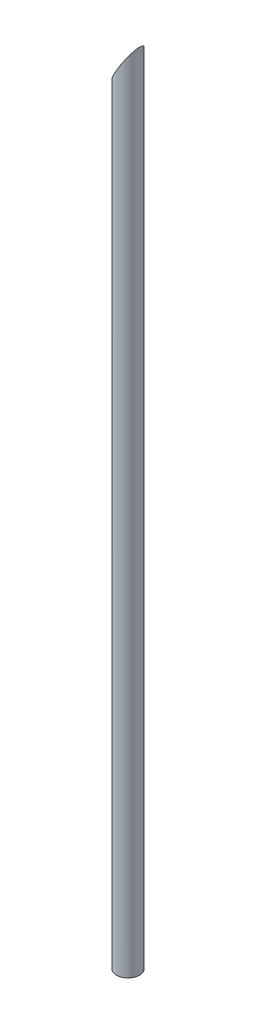
from build123d import *

# Parameters (mm, degrees)
SKETCH1_R               = 16.7005
SKETCH1_R_2             = 13.3223
BOSS_EXTRUDE1_DEPTH     = 1168.4
CUT_EXTRUDE1_DEPTH      = 1169.638683854
CUT_EXTRUDE1_DEPTH_BACK = 1169.638683854


with BuildPart() as part:
    # Sketch1 → Boss-Extrude1 (new body)
    with BuildSketch(Plane(origin=(0, 0, 0), x_dir=(1, 0, 0), z_dir=(0, 1, 0))):
        Circle(SKETCH1_R)
        Circle(SKETCH1_R_2, mode=Mode.SUBTRACT)
    extrude(amount=BOSS_EXTRUDE1_DEPTH)

    # Sketch2 → Cut-Extrude1 (cut, two sides: drawn at the far end of the back side and taken through both)
    with BuildSketch(Plane.XY.offset(-CUT_EXTRUDE1_DEPTH_BACK)):
        Polygon((16.7005, 1168.4), (-16.7005, 1168.4), (-16.7005, 1110.547770976), align=None)
    extrude(amount=CUT_EXTRUDE1_DEPTH + CUT_EXTRUDE1_DEPTH_BACK, mode=Mode.SUBTRACT)


solid = part.part
